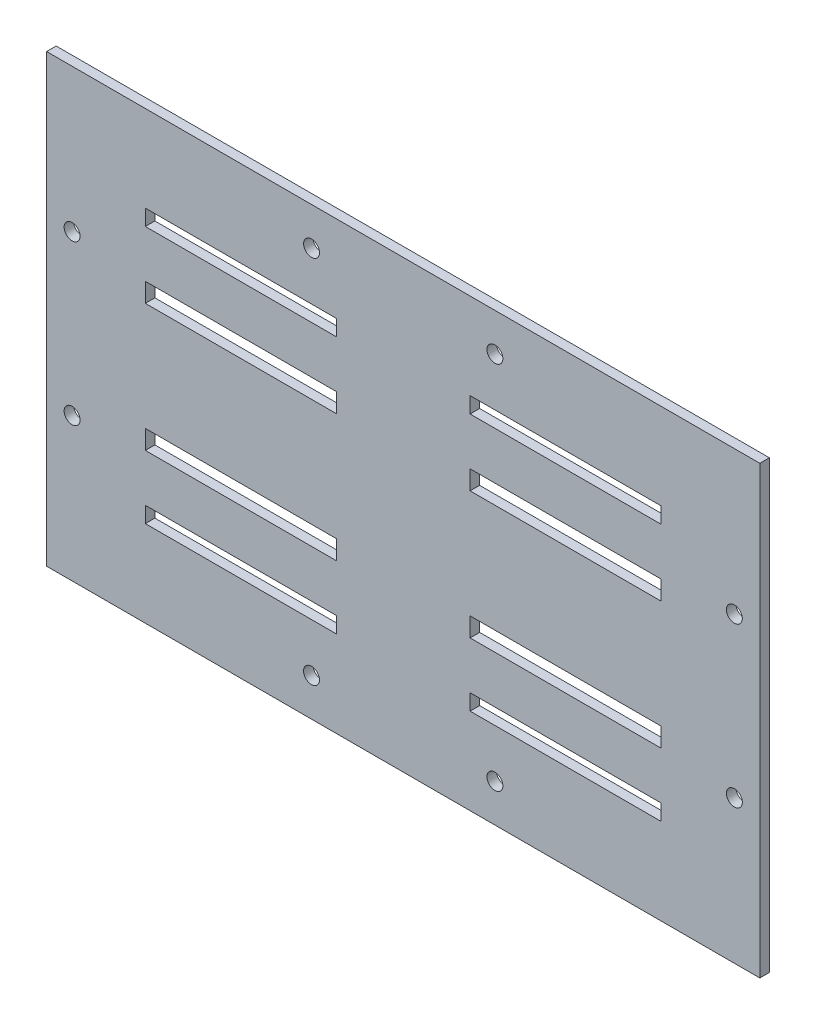
from build123d import *

# Parameters (mm, degrees)
SKETCH_2_W               = 200
SKETCH_2_H               = 140
EXTRUDE_1_DEPTH          = 3
SKETCH_4_W               = 60
SKETCH_4_H               = 6
CUT_EXTRUDE_2_DEPTH      = 10
SKETCH_5_W               = 60
SKETCH_5_H               = 5
CUT_EXTRUDE_3_DEPTH      = 6
SKETCH_6_R               = 2.5
CUT_EXTRUDE_4_DEPTH      = 5
SKETCH_9_W               = 3
SKETCH_9_H               = 140
EXTRUDE_2_DEPTH          = 12
SKETCH_10_W              = 3
SKETCH_10_H              = 140
EXTRUDE_3_DEPTH          = 12
SKETCH_11_R              = 2.5
CUT_EXTRUDE_5_DEPTH      = 12
MIRROR_2_COPY_1_SKETCH_W = 60
MIRROR_2_COPY_1_SKETCH_H = 5
MIRROR_2_COPY_1_DEPTH    = 6


with BuildPart() as part:
    # 草图2 → 凸台-拉伸1 (new body)
    with BuildSketch(Plane.XY):
        Rectangle(SKETCH_2_W, SKETCH_2_H)
    extrude(amount=EXTRUDE_1_DEPTH)

    # 草图4 → 切除-拉伸2 (cut)
    with BuildSketch(Plane.XY.offset(3)):
        with Locations((51, 20)):
            Rectangle(SKETCH_4_W, SKETCH_4_H)
        with Locations((51, -20)):
            Rectangle(SKETCH_4_W, SKETCH_4_H)
    cut_extrude_2 = extrude(amount=-CUT_EXTRUDE_2_DEPTH, mode=Mode.SUBTRACT)

    # 草图5 → 切除-拉伸3 (cut)
    with BuildSketch(Plane(origin=(0, 0, 0), x_dir=(-1, 0, 0), z_dir=(0, 0, -1))):
        with Locations((-51, 40.40876744)):
            Rectangle(SKETCH_5_W, SKETCH_5_H)
    cut_extrude_3 = extrude(amount=-CUT_EXTRUDE_3_DEPTH, mode=Mode.SUBTRACT)

    # 镜向1: 切除-拉伸3 across plane
    add(cut_extrude_3.mirror(Plane.ZX), mode=Mode.SUBTRACT)

    # 草图6 → 切除-拉伸4 (cut)
    with BuildSketch(Plane.XY.offset(3)):
        with Locations((-28.8, 58.108563741)):
            Circle(SKETCH_6_R)
        with Locations((-28.8, -58.108563741)):
            Circle(SKETCH_6_R)
        with Locations((28.8, -58.108563741)):
            Circle(SKETCH_6_R)
        with Locations((28.8, 58.108563741)):
            Circle(SKETCH_6_R)
    extrude(amount=-CUT_EXTRUDE_4_DEPTH, mode=Mode.SUBTRACT)

    # 草图9 → 凸台-拉伸2 (add)
    with BuildSketch(Plane(origin=(100, 0, 0), x_dir=(0, 0, -1), z_dir=(1, 0, 0))):
        with Locations((-1.5, 0)):
            Rectangle(SKETCH_9_W, SKETCH_9_H)
    extrude(amount=EXTRUDE_2_DEPTH)

    # 草图10 → 凸台-拉伸3 (add)
    with BuildSketch(Plane.ZY.offset(100)):
        with Locations((1.5, 0)):
            Rectangle(SKETCH_10_W, SKETCH_10_H)
    extrude(amount=EXTRUDE_3_DEPTH)

    # 草图11 → 切除-拉伸5 (cut)
    with BuildSketch(Plane.XY.offset(3)):
        with Locations((104, 25)):
            Circle(SKETCH_11_R)
        with Locations((104, -25)):
            Circle(SKETCH_11_R)
    cut_extrude_5 = extrude(amount=-CUT_EXTRUDE_5_DEPTH, mode=Mode.SUBTRACT)

    # 镜向2: 切除-拉伸2, 切除-拉伸3, 切除-拉伸5 across plane
    add(cut_extrude_2.mirror(Plane(origin=(0, 0, 0), x_dir=(0, 0, 1), z_dir=(1, 0, 0))), mode=Mode.SUBTRACT)
    add(cut_extrude_3.mirror(Plane(origin=(0, 0, 0), x_dir=(0, 0, 1), z_dir=(1, 0, 0))), mode=Mode.SUBTRACT)
    add(cut_extrude_5.mirror(Plane(origin=(0, 0, 0), x_dir=(0, 0, 1), z_dir=(1, 0, 0))), mode=Mode.SUBTRACT)

    # 镜向2 copy 1 sketch → 镜向2 copy 1 (cut)
    with BuildSketch(Plane(origin=(0, 0, 0), x_dir=(1, 0, 0), z_dir=(0, 0, -1))):
        with Locations((-51, 40.40876744)):
            Rectangle(MIRROR_2_COPY_1_SKETCH_W, MIRROR_2_COPY_1_SKETCH_H)
    extrude(amount=-MIRROR_2_COPY_1_DEPTH, mode=Mode.SUBTRACT)


solid = part.part
